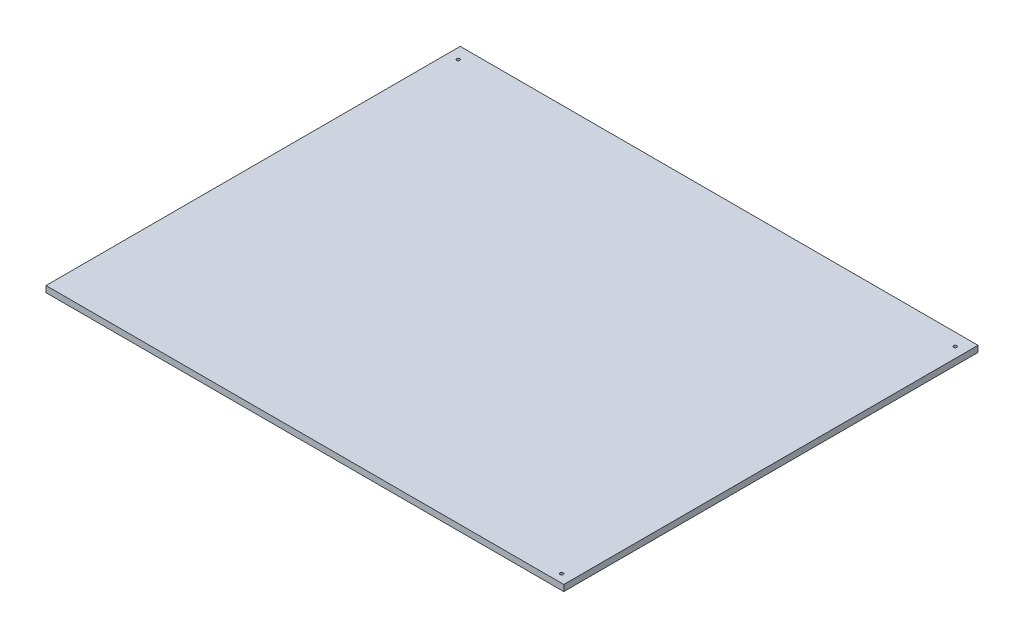
from build123d import *

# Parameters (mm, degrees)
SKETCH1_W           = 500
SKETCH1_H           = 400
SKETCH1_R           = 1.525
SKETCH1_R_2         = 1.5
BOSS_EXTRUDE1_DEPTH = 6


with BuildPart() as part:
    # Sketch1 → Boss-Extrude1 (new body)
    with BuildSketch(Plane(origin=(0, 0, 0), x_dir=(1, 0, 0), z_dir=(0, 1, 0))):
        with Locations((250, -200)):
            Rectangle(SKETCH1_W, SKETCH1_H)
        with Locations((490, -12)):
            Circle(SKETCH1_R, mode=Mode.SUBTRACT)
        with Locations((10, -12)):
            Circle(SKETCH1_R, mode=Mode.SUBTRACT)
        with Locations((490, -392)):
            Circle(SKETCH1_R_2, mode=Mode.SUBTRACT)
    extrude(amount=BOSS_EXTRUDE1_DEPTH)


solid = part.part
